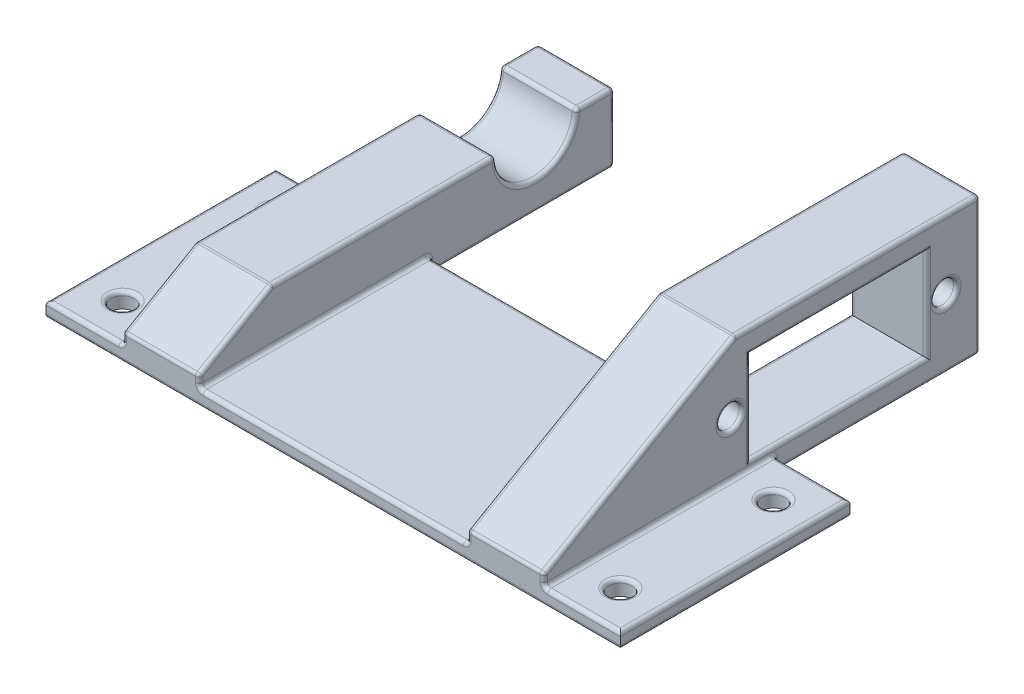
from build123d import *

# Parameters (mm, degrees)
SKETCH4_W               = 75
SKETCH4_H               = 30
BOSS_EXTRUDE3_DEPTH     = 2
SKETCH5_W               = 57
SKETCH5_H               = 18
BOSS_EXTRUDE4_DEPTH     = 5
CUT_EXTRUDE2_DEPTH      = 80.454389432
CUT_EXTRUDE2_DEPTH_BACK = 80.454389432
SKETCH6_W               = 23
SKETCH6_H               = 12
BOSS_EXTRUDE5_DEPTH     = 10
SKETCH8_R               = 1.5
CUT_EXTRUDE3_DEPTH      = 59.53417805
SKETCH9_R               = 1.5
CUT_EXTRUDE4_DEPTH      = 72.505244563
CHAMFER1_SIZE           = 25
CHAMFER1_SIZE2          = 14.43375673
CHAMFER2_SIZE           = 5.5
CHAMFER2_SIZE2          = 9.526279442
FILLET1_R               = 0.5


with BuildPart() as part:
    # Sketch4 → Boss-Extrude3 (new body)
    with BuildSketch(Plane(origin=(0, 0, 0), x_dir=(1, 0, 0), z_dir=(0, 1, 0))):
        Rectangle(SKETCH4_W, SKETCH4_H)
    extrude(amount=BOSS_EXTRUDE3_DEPTH)

    # Sketch5 → Boss-Extrude4 (add, symmetric)
    with BuildSketch(Plane(origin=(22.5, 0, 0), x_dir=(0, 0, -1), z_dir=(1, 0, 0))):
        with Locations((13.5, 9)):
            Rectangle(SKETCH5_W, SKETCH5_H)
    extrude(amount=BOSS_EXTRUDE4_DEPTH, both=True)

    # Sketch6 → Cut-Extrude2 (cut, two sides: drawn at the far end of the back side and taken through both)
    with BuildSketch(Plane(origin=(27.5, 0, 0), x_dir=(0, 0, -1), z_dir=(1, 0, 0)).offset(-CUT_EXTRUDE2_DEPTH_BACK)):
        with Locations((23.5, 9)):
            Rectangle(SKETCH6_W, SKETCH6_H)
    extrude(amount=CUT_EXTRUDE2_DEPTH + CUT_EXTRUDE2_DEPTH_BACK, mode=Mode.SUBTRACT)

    # Sketch7 → Boss-Extrude5 (add)
    with BuildSketch(Plane.ZY.offset(17.5)):
        with BuildLine():
            Line((-23.75, 9), (15, 9))
            Line((15, 9), (15, 0))
            Line((15, 0), (-39.25, 0))
            Line((-39.25, 0), (-39.25, 9))
            Line((-39.25, 9), (-34.25, 9))
            ThreePointArc((-34.25, 9), (-29, 3.75), (-23.75, 9))
        make_face()
    extrude(amount=BOSS_EXTRUDE5_DEPTH)

    # Sketch8 → Cut-Extrude3 (cut, through all)
    with BuildSketch(Plane(origin=(0, 2, 0), x_dir=(1, 0, 0), z_dir=(0, 1, 0))):
        with Locations(Location((-32.5, 10, 0), (0, 0, 270))):
            Circle(SKETCH8_R)
        with Locations(Location((-32.5, -10, 0), (0, 0, 270))):
            Circle(SKETCH8_R)
        with Locations(Location((32.5, 10, 0), (0, 0, 270))):
            Circle(SKETCH8_R)
        with Locations(Location((32.5, -10, 0), (0, 0, 270))):
            Circle(SKETCH8_R)
    extrude(amount=-CUT_EXTRUDE3_DEPTH, mode=Mode.SUBTRACT)

    # Sketch9 → Cut-Extrude4 (cut, through all)
    with BuildSketch(Plane.ZY.offset(-17.5)):
        with Locations((-9.5, 9)):
            Circle(SKETCH9_R)
        with Locations((-37.5, 9)):
            Circle(SKETCH9_R)
    extrude(amount=-CUT_EXTRUDE4_DEPTH, mode=Mode.SUBTRACT)

    # Chamfer1
    chamfer1_edges = [part.edges().sort_by_distance(p)[0] for p in [
        (22.5, 18, 15),
    ]]
    chamfer1_side = [part.faces().sort_by_distance(p)[0] for p in [
        (22.5, 18, -13.5),
    ]]
    chamfer(chamfer1_edges, length=CHAMFER1_SIZE, length2=CHAMFER1_SIZE2, reference=chamfer1_side[0])

    # Chamfer2
    chamfer2_edges = [part.edges().sort_by_distance(p)[0] for p in [
        (-22.5, 9, 15),
    ]]
    chamfer2_side = [part.faces().sort_by_distance(p)[0] for p in [
        (18.255380699, 2.783121635, 15),
    ]]
    chamfer(chamfer2_edges, length=CHAMFER2_SIZE, length2=CHAMFER2_SIZE2, reference=chamfer2_side[0])

    # Fillet1
    fillet1_edges = [part.edges().sort_by_distance(p)[0] for p in [
        (-32.5, 2, -11.5),
        (27.5, 9, -11),
        (17.5, 9, -11),
        (27.5, 9, -39),
        (17.5, 9, -39),
        (27.5, 2.783121635, 15),
        (17.5, 2.783121635, 15),
        (22.5, 3.56624327, 15),
        (17.5, 10.783121635, 2.5),
        (22.5, 18, -10),
        (27.5, 10.783121635, 2.5),
        (-17.5, 9, -9.138139721),
        (-27.5, 9, -9.138139721),
        (-22.5, 9, 5.473720558),
        (-17.5, 6.25, 10.236860279),
        (-22.5, 3.5, 15),
        (-27.5, 6.25, 10.236860279),
        (-37.5, 2, 0),
        (0, 0, -15),
        (0, 2, -15),
        (32.5, 2, 15),
        (-32.5, 2, 15),
        (17.5, 0, -28.5),
        (27.5, 2, 0),
        (27.5, 1, -15),
        (27.5, 0, -28.5),
        (27.5, 9, -42),
        (27.5, 18, -26),
        (17.5, 9, -42),
        (22.5, 0, -42),
        (17.5, 18, -26),
        (22.5, 18, -42),
        (17.5, 2, 0),
        (17.5, 1, -15),
        (17.5, 15, -23.5),
        (17.5, 9, -12),
        (17.5, 3, -23.5),
        (17.5, 9, -35),
        (27.5, 9, -35),
        (27.5, 3, -23.5),
        (27.5, 9, -12),
        (27.5, 15, -23.5),
        (37.5, 2, 0),
        (0, 0, 15),
        (-37.5, 0, 0),
        (32.5, 0, -15),
        (37.5, 0, 0),
        (-32.5, 0, -15),
        (0, 2, 15),
        (-32.5, 2, -15),
        (-17.5, 0, -27.125),
        (-22.5, 0, -39.25),
        (-17.5, 2.75, 15),
        (-27.5, 2.75, 15),
        (-27.5, 3.75, -29),
        (-27.5, 9, -36.75),
        (-27.5, 4.5, -39.25),
        (-27.5, 0, -27.125),
        (-17.5, 2, 0),
        (-17.5, 1, -15),
        (-17.5, 3.75, -29),
        (-22.5, 9, -23.75),
        (-17.5, 9, -36.75),
        (-22.5, 9, -34.25),
        (-17.5, 4.5, -39.25),
        (-22.5, 9, -39.25),
        (-27.5, 2, 0),
        (-27.5, 1, -15),
        (32.5, 2, -15),
        (-32.5, 2, 8.5),
        (32.5, 2, -11.5),
        (32.5, 2, 8.5),
    ]]
    fillet(fillet1_edges, radius=FILLET1_R - 0.0001)  # a hair under: the kernel refuses the full size


solid = part.part
